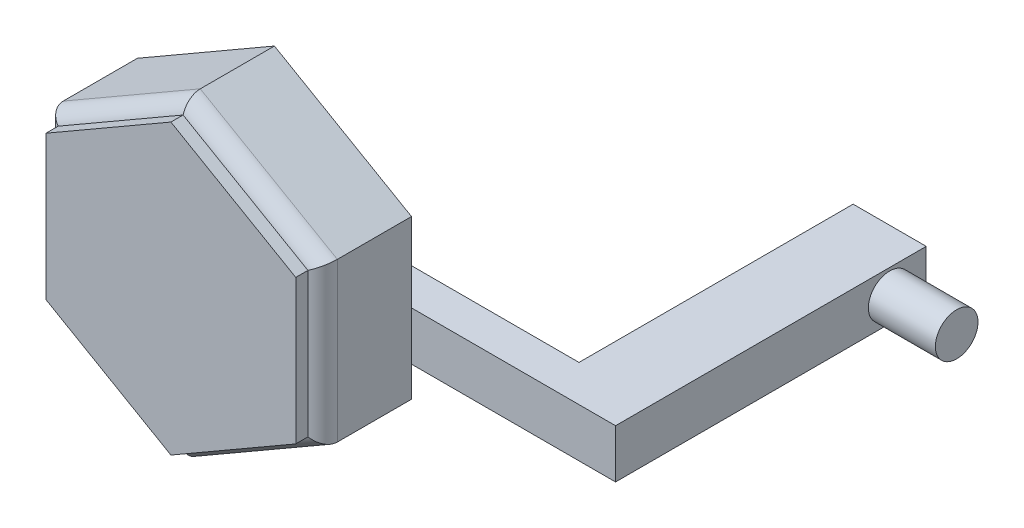
from build123d import *

# Parameters (mm, degrees)
BOSS_EXTRUDE1_DEPTH = 15
BOSS_EXTRUDE2_DEPTH = 2
FILLET1_R           = 3
SKETCH3_W           = 56
SKETCH3_H           = 8
BOSS_EXTRUDE3_DEPTH = 6
SKETCH4_W           = 12
SKETCH4_H           = 8
BOSS_EXTRUDE4_DEPTH = 45
SKETCH5_R           = 3.5
BOSS_EXTRUDE5_DEPTH = 11
FILLET2_R           = 4


with BuildPart() as part:
    # Sketch1 → Boss-Extrude1 (new body)
    with BuildSketch(Plane.XY):
        Polygon((0, 25.980762114), (-22.5, 12.990381057), (-22.5, -12.990381057), (0, -25.980762114), (22.5, -12.990381057), (22.5, 12.990381057), align=None)
    extrude(amount=BOSS_EXTRUDE1_DEPTH)

    # Sketch2 → Boss-Extrude2 (add)
    with BuildSketch(Plane.XY.offset(15)):
        Polygon((20.5, 11.835680518), (0, 23.671361037), (-20.5, 11.835680518), (-20.5, -11.835680518), (0, -23.671361037), (20.5, -11.835680518), align=None)
    extrude(amount=BOSS_EXTRUDE2_DEPTH)

    # Fillet1
    # the kernel refuses this fillet: 3 mm, written as the material it takes off along each edge
    with BuildSketch(Plane(origin=(-22.5, 20.061448869, 15), x_dir=(0, 0, -1), z_dir=(0, -1, 0)), Plane(origin=(28.623724357, 9.454847151, 15), x_dir=(0, 0, -1), z_dir=(-0.8660254037844388, 0.4999999999999997, 0)), Plane(origin=(6.123724357, 29.516296019, 15), x_dir=(0, 0, -1), z_dir=(-0.8660254037844386, -0.5000000000000003, 0))) as fillet1_piece_1:
        with BuildLine():
            CenterArc((2.828427125, 3), FILLET1_R, 199.471220634, 70.528779366)
            Line((0, 2), (-0.056568542, 1.98))
            ThreePointArc((-0.056568542, 1.98), (-0.06, 1), (-0.06, 0))
            Line((-0.06, 0), (0, -0.06))
            Line((0, -0.06), (2.828427125, -0.06))
            Line((2.828427125, -0.06), (2.828427125, 0))
        make_face()
    extrude(amount=40.122897737, mode=Mode.SUBTRACT)
    with BuildSketch(Plane(origin=(-28.623724357, -9.454847151, 15), x_dir=(0.5000000000000002, 0.8660254037844386, 0), z_dir=(0.8660254037844386, -0.5000000000000002, 0)), Plane(origin=(-6.123724357, -29.516296019, 15), x_dir=(-0.5000000000000003, 0.8660254037844386, 0), z_dir=(0.8660254037844385, 0.5000000000000003, 0)), Plane(origin=(22.5, -20.061448869, 15), x_dir=(-1, 0, 0), z_dir=(0, 1, 0))) as fillet1_piece_2:
        with BuildLine():
            CenterArc((3, -2.828427125), FILLET1_R, 109.471220634, 70.528779366)
            Line((0, -2.828427125), (-0.06, -2.828427125))
            Line((-0.06, -2.828427125), (-0.06, 0))
            Line((-0.06, 0), (0, 0.06))
            ThreePointArc((0, 0.06), (1, 0.06), (1.98, 0.056568542))
            Line((1.98, 0.056568542), (2, 0))
        make_face()
    extrude(amount=40.122897737, mode=Mode.SUBTRACT)

    # Sketch3 → Boss-Extrude3 (add)
    with BuildSketch(Plane(origin=(0, 0, 0), x_dir=(-1, 0, 0), z_dir=(0, 0, -1))):
        with Locations((-28, -4)):
            Rectangle(SKETCH3_W, SKETCH3_H)
    extrude(amount=BOSS_EXTRUDE3_DEPTH)

    # Sketch4 → Boss-Extrude4 (add)
    with BuildSketch(Plane(origin=(0, 0, -6), x_dir=(-1, 0, 0), z_dir=(0, 0, -1))):
        with Locations((-50, -4)):
            Rectangle(SKETCH4_W, SKETCH4_H)
    extrude(amount=BOSS_EXTRUDE4_DEPTH)

    # Sketch5 → Boss-Extrude5 (add)
    with BuildSketch(Plane(origin=(56, 0, 0), x_dir=(0, 0, -1), z_dir=(1, 0, 0))):
        with Locations(Location((45, -4, 0), (0, 0, 180))):
            Circle(SKETCH5_R)
    extrude(amount=BOSS_EXTRUDE5_DEPTH)

    # Fillet2
    fillet2_edges = [part.edges().sort_by_distance(p)[0] for p in [
        (0, -4, -6),
    ]]
    fillet(fillet2_edges, radius=FILLET2_R)


solid = part.part
